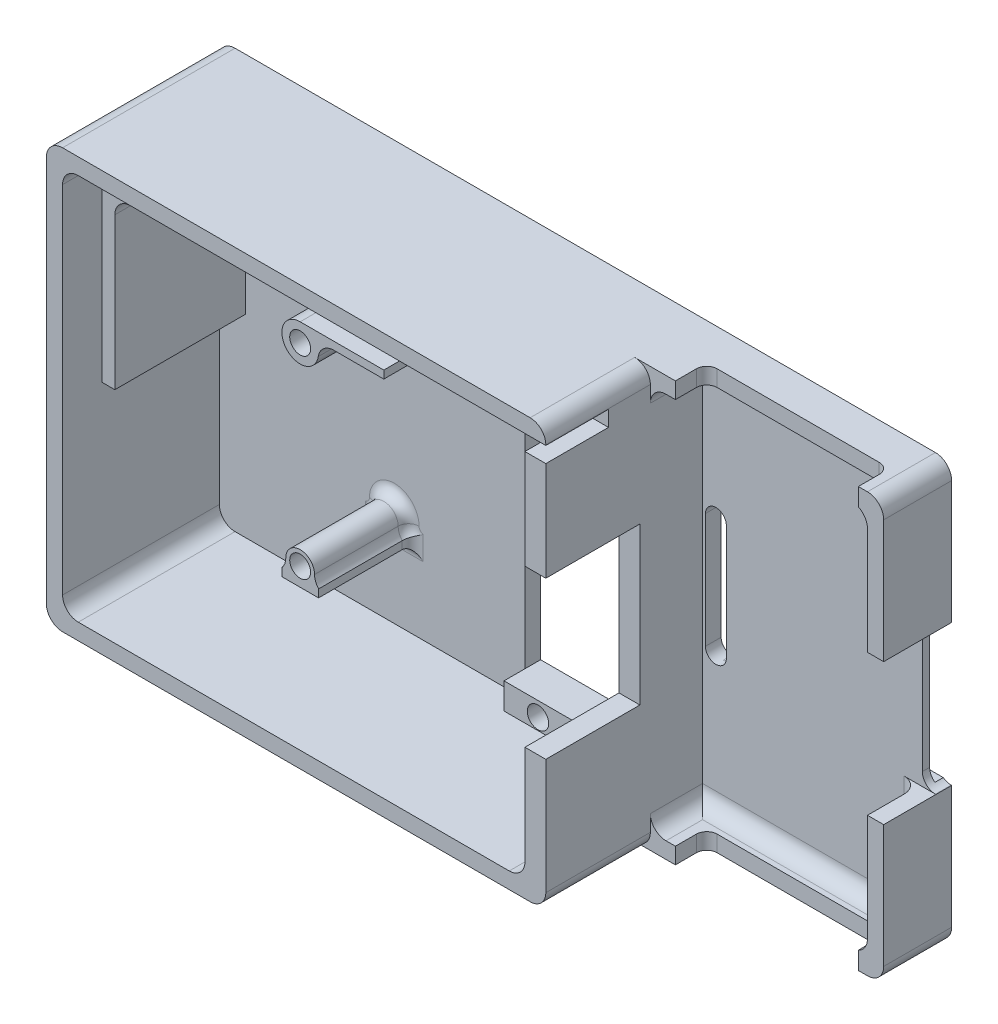
from build123d import *

# Parameters (mm, degrees)
SKETCH1_W              = 140
SKETCH1_H              = 80
SKETCH1_R              = 1.7
SKETCH1_R_2            = 1.85
SKETCH1_W_2            = 30
SKETCH1_H_2            = 64
BOSS_EXTRUDE1_DEPTH    = 3
LIPO_STRAP_DEPTH       = 3
FILLET1_R              = 3
WALL_DEPTH             = 30
WALL_DIRECTION_2_REACH = 88.341
SKETCH4_W              = 30
SKETCH4_H              = 6.07780277
SKETCH4_R              = 2.05
SERVO_BOLTS_DEPTH      = 4
SKETCH5_W              = 4
SKETCH5_H              = 74
LIPO_WALL_DEPTH        = 30
SKETCH6_R              = 3.5
SKETCH6_R_2            = 2
SKETCH6_R_3            = 2.75
PCB_STANDOFF_DEPTH     = 18
SKETCH8_W              = 4
SKETCH8_H              = 3
WIRE_2_DEPTH           = 12
SKETCH9_W              = 84.893473151
SKETCH9_H              = 106.193160462
CUT_EXTRUDE3_DEPTH     = 20
FILLET2_R              = 3
SKETCH10_W             = 46.265699575
SKETCH10_H             = 26
CUT_EXTRUDE4_DEPTH     = 1.6
SKETCH11_W             = 7.044911652
SKETCH11_H             = 1.491863032
SKETCH11_W_2           = 16
SKETCH11_H_2           = 1.5
BOSS_EXTRUDE6_DEPTH    = 18
FILLET4_R              = 3
FILLET5_R              = 2
FILLET6_R              = 3
SKETCH12_W             = 35
SKETCH12_H             = 100
CUT_EXTRUDE5_DEPTH     = 6
FILLET7_R              = 2
BOSS_EXTRUDE7_DEPTH    = 25
SKETCH14_W             = 20.051449776
SKETCH14_H             = 30
CUT_EXTRUDE6_DEPTH     = 18


with BuildPart() as part:
    # Sketch1 → Boss-Extrude1 (new body)
    with BuildSketch(Plane.XY):
        with Locations((-6.457193845, 0)):
            Rectangle(SKETCH1_W, SKETCH1_H)
        with Locations((-8.5, 34.8)):
            Circle(SKETCH1_R, mode=Mode.SUBTRACT)
        with Locations((8.5, 34.8)):
            Circle(SKETCH1_R, mode=Mode.SUBTRACT)
        with Locations(Location((8.5, -34.8, 0), (0, 0, 180))):
            Circle(SKETCH1_R, mode=Mode.SUBTRACT)
        with Locations(Location((-8.5, -34.8, 0), (0, 0, 180))):
            Circle(SKETCH1_R, mode=Mode.SUBTRACT)
        with Locations((-40, 18.5)):
            Circle(SKETCH1_R_2, mode=Mode.SUBTRACT)
        with Locations(Location((-40, -18.5, 0), (0, 0, 180))):
            Circle(SKETCH1_R_2, mode=Mode.SUBTRACT)
        Rectangle(SKETCH1_W_2, SKETCH1_H_2, mode=Mode.SUBTRACT)
        with BuildLine():
            Line((19.542806155, -11), (19.542806155, 11))
            ThreePointArc((19.542806155, 11), (21.542806155, 13), (23.542806155, 11))
            Line((23.542806155, 11), (23.542806155, -11))
            ThreePointArc((23.542806155, -11), (21.542806155, -13), (19.542806155, -11))
        make_face(mode=Mode.SUBTRACT)
    extrude(amount=BOSS_EXTRUDE1_DEPTH)

    # Sketch2 → lipo strap (cut)
    with BuildSketch(Plane.XY.offset(3)):
        with BuildLine():
            Line((61.042806155, -11), (61.042806155, 11))
            ThreePointArc((61.042806155, 11), (63.542806155, 13.5), (66.042806155, 11))
            Line((66.042806155, 11), (66.042806155, -11))
            ThreePointArc((66.042806155, -11), (63.542806155, -13.5), (61.042806155, -11))
        make_face()
    extrude(amount=-LIPO_STRAP_DEPTH, mode=Mode.SUBTRACT)

    # Fillet1
    fillet1_edges = [part.edges().sort_by_distance(p)[0] for p in [
        (63.542806155, -40, 1.5),
        (-76.457193845, -40, 1.5),
        (-76.457193845, 40, 1.5),
        (63.542806155, 40, 1.5),
    ]]
    fillet(fillet1_edges, radius=FILLET1_R)

    # Sketch3 → wall (add)
    with BuildSketch(Plane.XY.offset(3)):
        with BuildLine():
            Line((60.542806155, 13.5), (63.642806155, 13.5))
            Line((63.642806155, 13.5), (63.642806155, 37))
            ThreePointArc((63.642806155, 37), (62.734837176, 39.192031022), (60.542806155, 40.1))
            Line((60.542806155, 40.1), (-73.457193845, 40.1))
            ThreePointArc((-73.457193845, 40.1), (-75.649224867, 39.192031022), (-76.557193845, 37))
            Line((-76.557193845, 37), (-76.557193845, -37))
            ThreePointArc((-76.557193845, -37), (-75.649224867, -39.192031022), (-73.457193845, -40.1))
            Line((-73.457193845, -40.1), (60.542806155, -40.1))
            ThreePointArc((60.542806155, -40.1), (62.734837176, -39.192031022), (63.642806155, -37))
            Line((63.642806155, -37), (63.642806155, -13.5))
            Line((63.642806155, -13.5), (60.542806155, -13.5))
            Line((60.542806155, -13.5), (60.542806155, -34))
            ThreePointArc((60.542806155, -34), (59.664126498, -36.121320344), (57.542806155, -37))
            Line((57.542806155, -37), (-70.457193845, -37))
            ThreePointArc((-70.457193845, -37), (-72.578514189, -36.121320344), (-73.457193845, -34))
            Line((-73.457193845, -34), (-73.457193845, 34))
            ThreePointArc((-73.457193845, 34), (-72.578514189, 36.121320344), (-70.457193845, 37))
            Line((-70.457193845, 37), (57.542806155, 37))
            ThreePointArc((57.542806155, 37), (59.664126498, 36.121320344), (60.542806155, 34))
            Line((60.542806155, 34), (60.542806155, 13.5))
        make_face()
    extrude(amount=WALL_DEPTH)

    # wall direction 2: up to this face of the body (flat: up to its plane)
    wall_direction_2_end = Plane(part.part.faces().sort_by_distance((-74.844742296, 0, 0))[0])
    # Sketch3 → wall direction 2 (add, up to the picked face)
    with BuildSketch(Plane.XY.offset(3), mode=Mode.PRIVATE) as wall_direction_2_sk1:
        with BuildLine():
            Line((60.542806155, 13.5), (63.642806155, 13.5))
            Line((63.642806155, 13.5), (63.642806155, 37))
            ThreePointArc((63.642806155, 37), (62.734837176, 39.192031022), (60.542806155, 40.1))
            Line((60.542806155, 40.1), (-73.457193845, 40.1))
            ThreePointArc((-73.457193845, 40.1), (-75.649224867, 39.192031022), (-76.557193845, 37))
            Line((-76.557193845, 37), (-76.557193845, -37))
            ThreePointArc((-76.557193845, -37), (-75.649224867, -39.192031022), (-73.457193845, -40.1))
            Line((-73.457193845, -40.1), (60.542806155, -40.1))
            ThreePointArc((60.542806155, -40.1), (62.734837176, -39.192031022), (63.642806155, -37))
            Line((63.642806155, -37), (63.642806155, -13.5))
            Line((63.642806155, -13.5), (60.542806155, -13.5))
            Line((60.542806155, -13.5), (60.542806155, -34))
            ThreePointArc((60.542806155, -34), (59.664126498, -36.121320344), (57.542806155, -37))
            Line((57.542806155, -37), (-70.457193845, -37))
            ThreePointArc((-70.457193845, -37), (-72.578514189, -36.121320344), (-73.457193845, -34))
            Line((-73.457193845, -34), (-73.457193845, 34))
            ThreePointArc((-73.457193845, 34), (-72.578514189, 36.121320344), (-70.457193845, 37))
            Line((-70.457193845, 37), (57.542806155, 37))
            ThreePointArc((57.542806155, 37), (59.664126498, 36.121320344), (60.542806155, 34))
            Line((60.542806155, 34), (60.542806155, 13.5))
        make_face()
    wall_direction_2_tool1 = split(extrude(wall_direction_2_sk1.sketch, amount=-WALL_DIRECTION_2_REACH, mode=Mode.PRIVATE), bisect_by=wall_direction_2_end, keep=Keep.BOTH, mode=Mode.PRIVATE)
    add(wall_direction_2_tool1.solids().sort_by(Axis((62.157987, 23.75, 3), (0, 0, -1)))[0])

    # Sketch4 → servo bolts (add)
    # profile 1 of 2: a face of its own
    with BuildSketch(Plane.XY.offset(3)):
        with Locations((0, 35.038901385)):
            Rectangle(SKETCH4_W, SKETCH4_H)
        with Locations((-8.5, 34.8)):
            Circle(SKETCH4_R, mode=Mode.SUBTRACT)
        with Locations((8.5, 34.8)):
            Circle(SKETCH4_R, mode=Mode.SUBTRACT)
    # profile 2 of 2: a face of its own
    with BuildSketch(Plane.XY.offset(3)):
        with Locations((0, -35.038901385)):
            Rectangle(SKETCH4_W, SKETCH4_H)
        with Locations(Location((8.5, -34.8, 0), (0, 0, 180))):
            Circle(SKETCH4_R, mode=Mode.SUBTRACT)
        with Locations(Location((-8.5, -34.8, 0), (0, 0, 180))):
            Circle(SKETCH4_R, mode=Mode.SUBTRACT)
    extrude(amount=SERVO_BOLTS_DEPTH)

    # Sketch5 → lipo wall (add)
    with BuildSketch(Plane.XY.offset(3)):
        with Locations((17, 0)):
            Rectangle(SKETCH5_W, SKETCH5_H)
    extrude(amount=LIPO_WALL_DEPTH)

    # Sketch6 → PCB standoff (add)
    # profile 1 of 2: a face of its own
    with BuildSketch(Plane.XY.offset(3)):
        with Locations(Location((-40, 18.5, 0), (0, 0, 180))):
            Circle(SKETCH6_R)
        with Locations((-40, 18.5)):
            Circle(SKETCH6_R_2, mode=Mode.SUBTRACT)
    # profile 2 of 2: a face of its own
    with BuildSketch(Plane.XY.offset(3)):
        with Locations(Location((-40, -18.5, 0), (0, 0, 180))):
            Circle(SKETCH6_R_3)
        with Locations((-40, -18.5)):
            Circle(SKETCH6_R_2, mode=Mode.SUBTRACT)
    extrude(amount=PCB_STANDOFF_DEPTH)

    # Sketch8 → wire 2 (cut)
    with BuildSketch(Plane.XY.offset(33)):
        with Locations((17, 35.5)):
            Rectangle(SKETCH8_W, SKETCH8_H)
    extrude(amount=-WIRE_2_DEPTH, mode=Mode.SUBTRACT)

    # Sketch9 → Cut-Extrude3 (cut)
    with BuildSketch(Plane.XY.offset(33)):
        with Locations((61.446736576, 0)):
            Rectangle(SKETCH9_W, SKETCH9_H)
    extrude(amount=-CUT_EXTRUDE3_DEPTH, mode=Mode.SUBTRACT)

    # Fillet2
    fillet2_edges = [part.edges().sort_by_distance(p)[0] for p in [
        (60.542806155, -23.75, 3),
        (59.664126498, -36.121320344, 3),
        (60.542806155, 23.75, 3),
        (59.664126498, 36.121320344, 3),
        (15, -37, 20),
        (15, 37, 14),
        (38.271403077, -37, 3),
        (19, -37, 8),
        (38.271403077, 37, 3),
        (19, 37, 8),
    ]]
    fillet(fillet2_edges, radius=FILLET2_R)

    # Sketch10 → Cut-Extrude4 (cut)
    with BuildSketch(Plane(origin=(0, 0, 0), x_dir=(-1, 0, 0), z_dir=(0, 0, -1))):
        with Locations((-44.675655943, 0)):
            Rectangle(SKETCH10_W, SKETCH10_H)
    extrude(amount=-CUT_EXTRUDE4_DEPTH, mode=Mode.SUBTRACT)

    # Sketch11 → Boss-Extrude6 (add)
    with BuildSketch(Plane.XY.offset(3)):
        with Locations((-40, -21.25)):
            Rectangle(SKETCH11_W, SKETCH11_H)
        with Locations((-32, 21.25)):
            Rectangle(SKETCH11_W_2, SKETCH11_H_2)
    extrude(amount=BOSS_EXTRUDE6_DEPTH)

    # Fillet4
    # the kernel refuses this fillet: 3 mm, written as the material it adds along each edge
    with BuildSketch(Plane(origin=(-41.883138208, -20.504068484, 21), x_dir=(-1.0, 1.8919573654777327e-12, 0), z_dir=(0, 0, -1))) as fillet4_piece_1:
        with BuildLine():
            CenterArc((3.866859234, 2.009492063), FILLET4_R, 180.05404317, 41.999955364)
            ThreePointArc((0.866860568, 2.006662369), (0.641374229, 0.913501222), (0, 0))
            Line((0, 0), (1.639317618, 0))
        make_face()
    extrude(amount=18)
    with BuildSketch(Plane(origin=(-38.116861792, -20.504068484, 21), x_dir=(1.0, 1.887622984429e-12, 0), z_dir=(0, 0, -1))) as fillet4_piece_2:
        with BuildLine():
            CenterArc((3.866859234, -2.009492063), FILLET4_R, 137.946001469, 41.999955362)
            ThreePointArc((0.866860568, -2.006662369), (0.641374229, -0.913501222), (0, 0))
            Line((0, 0), (1.639317618, 0))
        make_face()
    extrude(amount=18)
    with BuildSketch(Plane(origin=(-37.127718677, 20.5, 21), x_dir=(1, 0, 0), z_dir=(0, 0, -1))) as fillet4_piece_3:
        with BuildLine():
            CenterArc((3.550334966, 3), FILLET4_R, 188.849883098, 81.150116902)
            ThreePointArc((0.586050525, 2.538461538), (0.538013756, 1.212670671), (0, 0))
            Line((0, 0), (3.550334966, 0))
        make_face()
    extrude(amount=18)

    # Fillet5
    fillet5_edges = [part.edges().sort_by_distance(p)[0] for p in [
        (-36.477544174, -21.25, 3),
        (-43.522455826, -21.25, 3),
        (-40, -21.995931516, 3),
        (-42.658440839, 16.223447275, 3),
        (-24, 21.25, 3),
        (-32, 22, 3),
        (-40, -15.75, 3),
        (-28.788691855, 20.5, 3),
        (-35.528714617, 19.778663576, 3),
        (-37.04972894, -19.572320447, 3),
        (-42.95027106, -19.572320447, 3),
    ]]
    fillet(fillet5_edges, radius=FILLET5_R)

    # Fillet6
    fillet6_edges = [part.edges().sort_by_distance(p)[0] for p in [
        (19, 40.1, 23),
        (19, -40.1, 23),
    ]]
    fillet(fillet6_edges, radius=FILLET6_R)

    # Sketch12 → Cut-Extrude5 (cut)
    with BuildSketch(Plane.XY.offset(13)):
        with Locations((41.292806155, 0)):
            Rectangle(SKETCH12_W, SKETCH12_H)
    extrude(amount=-CUT_EXTRUDE5_DEPTH, mode=Mode.SUBTRACT)

    # Fillet7
    fillet7_edges = [part.edges().sort_by_distance(p)[0] for p in [
        (58.792806155, 38.413589014, 7),
        (58.792806155, -38.413589014, 7),
        (23.792806155, -38.55, 7),
        (23.792806155, 38.55, 7),
    ]]
    fillet(fillet7_edges, radius=FILLET7_R)

    # Sketch13 → Boss-Extrude7 (add)
    with BuildSketch(Plane.XY.offset(3)):
        with BuildLine():
            Line((-70.957193845, 31.5), (-70.957193845, 0.014955839))
            Line((-70.957193845, 0.014955839), (-68.457193845, 0.014955839))
            Line((-68.457193845, 0.014955839), (-68.457193845, 29))
            ThreePointArc((-68.457193845, 29), (-67.578514189, 31.121320344), (-65.457193845, 32))
            Line((-65.457193845, 32), (-15, 32))
            Line((-15, 32), (-15, 34.5))
            Line((-15, 34.5), (-67.957193845, 34.5))
            ThreePointArc((-67.957193845, 34.5), (-70.078514189, 33.621320344), (-70.957193845, 31.5))
        make_face()
    extrude(amount=BOSS_EXTRUDE7_DEPTH)

    # Sketch14 → Cut-Extrude6 (cut)
    with BuildSketch(Plane.XY.offset(33)):
        with Locations((15, 0)):
            Rectangle(SKETCH14_W, SKETCH14_H)
    extrude(amount=-CUT_EXTRUDE6_DEPTH, mode=Mode.SUBTRACT)


solid = part.part
